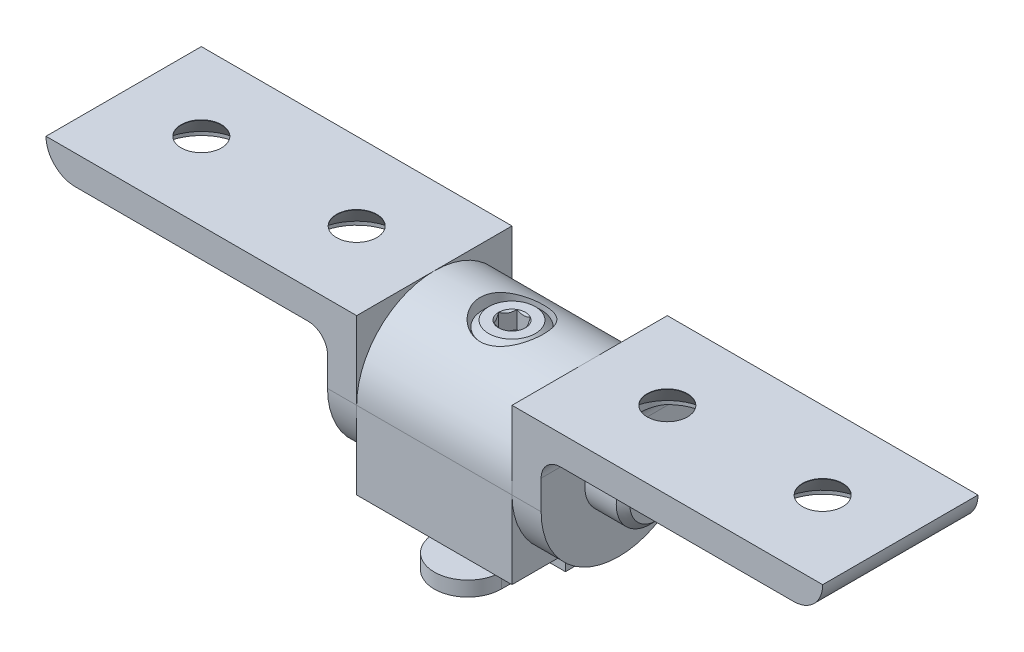
from build123d import *

# Parameters (mm, degrees)
SKETCH2_R           = 3.175
BOSS_EXTRUDE1_DEPTH = 12.7
SKETCH4_W           = 7.9248
SKETCH4_H           = 2.54
BOSS_EXTRUDE3_DEPTH = 3.9624
BOSS_EXTRUDE8_DEPTH = 12.7
SKETCH23_R          = 4.7625
CUT_EXTRUDE7_DEPTH  = 55.091601994
LPATTERN1_COUNT     = 2
LPATTERN1_PITCH     = 25.4
CUT_EXTRUDE1_DEPTH  = 2.8575
SKETCH12_R          = 5.191125
CUT_EXTRUDE3_DEPTH  = 69.063588118
SKETCH13_R          = 3.29819
CUT_EXTRUDE4_DEPTH  = 69.063588118
SKETCH14_R          = 3.175
BOSS_EXTRUDE6_DEPTH = 2.413
SKETCH16_R          = 3.175
BOSS_EXTRUDE7_DEPTH = 25.4
CUT_EXTRUDE5_DEPTH  = 2.8575
CUT_SWEEP1_PITCH    = 1.27
CUT_SWEEP1_FROM     = 0


with BuildPart() as part:
    # Sketch2 → Boss-Extrude1 (new, symmetric)
    with BuildSketch(Plane(origin=(0, 0, 0), x_dir=(0, 0, -1), z_dir=(1, 0, 0))):
        with BuildLine():
            ThreePointArc((-12.7, 12.7), (0, 25.4), (12.7, 12.7))
            Line((12.7, 12.7), (12.7, 0))
            Line((12.7, 0), (-12.7, 0))
            Line((-12.7, 0), (-12.7, 12.7))
        make_face()
        with Locations((0, 12.7)):
            Circle(SKETCH2_R, mode=Mode.SUBTRACT)
    extrude(amount=BOSS_EXTRUDE1_DEPTH, both=True)

    # Sketch4 → Boss-Extrude3 (add, symmetric)
    with BuildSketch(Plane.XY):
        with Locations((8.7376, -1.27)):
            Rectangle(SKETCH4_W, SKETCH4_H)
        with Locations((-8.7376, -1.27)):
            Rectangle(SKETCH4_W, SKETCH4_H)
    extrude(amount=BOSS_EXTRUDE3_DEPTH, both=True)

    # Sketch12 → Cut-Extrude3 (cut, through all)
    with BuildSketch(Plane(origin=(0, 18.415, 0), x_dir=(1, 0, 0), z_dir=(0, 1, 0))):
        with Locations(Location((0, 0, 0), (0, 0, 180))):
            Circle(SKETCH12_R)
    extrude(amount=CUT_EXTRUDE3_DEPTH, mode=Mode.SUBTRACT)

    # Sketch13 → Cut-Extrude4 (cut, through all)
    with BuildSketch(Plane(origin=(0, 18.415, 0), x_dir=(1, 0, 0), z_dir=(0, 1, 0))):
        with Locations(Location((0, 0, 0), (0, 0, 270))):
            Circle(SKETCH13_R)
    extrude(amount=-CUT_EXTRUDE4_DEPTH, mode=Mode.SUBTRACT)


with BuildPart() as body_2:
    # Sketch22 → Boss-Extrude8 (new, symmetric)
    with BuildSketch(Plane.XY):
        with BuildLine():
            Line((-12.7, 0), (-12.7, 25.4))
            Line((-12.7, 25.4), (-63.5, 25.4))
            ThreePointArc((-63.5, 25.4), (-62.105096045, 22.032403955), (-58.7375, 20.6375))
            Line((-58.7375, 20.6375), (-20.6375, 20.6375))
            ThreePointArc((-20.6375, 20.6375), (-18.39243597, 19.70756403), (-17.4625, 17.4625))
            Line((-17.4625, 17.4625), (-17.4625, 0))
            Line((-17.4625, 0), (-12.7, 0))
        make_face()
    extrude(amount=BOSS_EXTRUDE8_DEPTH, both=True)

    # Sketch23 → Cut-Extrude7 (cut, through all)
    with BuildSketch(Plane.ZY.offset(17.4625)):
        with Locations((0, 12.7)):
            Circle(SKETCH23_R)
        with BuildLine():
            Line((-12.7, 12.7), (-12.7, -6.985))
            Line((-12.7, -6.985), (12.7, -6.985))
            Line((12.7, -6.985), (12.7, 12.7))
            ThreePointArc((12.7, 12.7), (0, 0), (-12.7, 12.7))
        make_face()
    extrude(amount=-CUT_EXTRUDE7_DEPTH, mode=Mode.SUBTRACT)

    # Sketch24 → Cut-Revolve1 (revolve, cut)
    with BuildSketch(Plane.XY, mode=Mode.PRIVATE) as cut_revolve1_sk:
        Polygon((-54.09819, 25.4), (-54.09819, 25.331851349), (-57.68213, 21.209), (-57.68213, 20.6375), (-57.68213, 12.7), (-50.8, 12.7), (-50.8, 20.6375), (-50.8, 25.4), align=None)
    cut_revolve1 = revolve(cut_revolve1_sk.sketch.rotate(Axis((-50.8, 0, 0), (0, 1, 0)), 180), axis=Axis((-50.8, 0, 0), (0, 1, 0)), mode=Mode.SUBTRACT)

    # LPattern1: Cut-Revolve1 ×2
    with Locations(*[(i * LPATTERN1_PITCH, 0, 0) for i in range(1, LPATTERN1_COUNT)]):
        add(cut_revolve1, mode=Mode.SUBTRACT)


with BuildPart() as body_3:
    # Sketch8 → Revolve1 (revolve)
    with BuildSketch(Plane.XY, mode=Mode.PRIVATE) as revolve1_sk:
        Polygon((-22.59965, 18.25625), (-17.4625, 18.25625), (-17.4625, 17.4625), (-12.7, 17.4625), (-12.7, 15.875), (-6.35, 15.875), (-6.35, 12.7), (-23.7109, 12.7), (-23.7109, 17.145), align=None)
    revolve(revolve1_sk.sketch.rotate(Axis((-23.7109, 12.7, 0), (1, 0, 0)), 90), axis=Axis((-23.7109, 12.7, 0), (1, 0, 0)))

    # Sketch9 → Cut-Extrude1 (cut)
    with BuildSketch(Plane.ZY.offset(23.7109)):
        Polygon((0, 14.899704526), (-1.905, 13.799852263), (-1.905, 11.600147737), (0, 10.500295474), (1.905, 11.600147737), (1.905, 13.799852263), align=None)
    extrude(amount=-CUT_EXTRUDE1_DEPTH, mode=Mode.SUBTRACT)

    # Cut-Extrude2 cone 1 section (through the dimple's axis) → Cut-Extrude2 (revolve, cut)
    with BuildSketch(Plane(origin=(-23.7109, 12.7, 0), x_dir=(0, 0, 1), z_dir=(0, 1, 0))):
        Polygon((0, 0), (2.199704526, 0), (0, 2.199704526), align=None)
    revolve(axis=Axis((-23.7109, 12.7, 0), (1, 0, 0)), mode=Mode.SUBTRACT)


with BuildPart() as body_4:
    # Mirror2: mirrored copy
    add(body_3.part.mirror(Plane(origin=(0, 0, 0), x_dir=(0, 0, 1), z_dir=(1, 0, 0))))


with BuildPart() as body_5:
    # Mirror2 2: mirrored copy
    add(body_2.part.mirror(Plane(origin=(0, 0, 0), x_dir=(0, 0, 1), z_dir=(1, 0, 0))))


with BuildPart() as body_6:
    # Sketch14 → Boss-Extrude6 (new body)
    with BuildSketch(Plane(origin=(0, -6.985, 0), x_dir=(1, 0, 0), z_dir=(0, 1, 0))):
        with BuildLine():
            Line((5.476875, 7.223125), (5.476875, -7.223125))
            ThreePointArc((5.476875, -7.223125), (0, -12.7), (-5.476875, -7.223125))
            Line((-5.476875, -7.223125), (-5.476875, 7.223125))
            ThreePointArc((-5.476875, 7.223125), (0, 12.7), (5.476875, 7.223125))
        make_face()
        with Locations(Location((0, 0, 0), (0, 0, 270))):
            Circle(SKETCH14_R, mode=Mode.SUBTRACT)
    extrude(amount=BOSS_EXTRUDE6_DEPTH)


with BuildPart() as body_7:
    # Sketch16 → Boss-Extrude7 (new body)
    with BuildSketch(Plane(origin=(0, 18.415, 0), x_dir=(1, 0, 0), z_dir=(0, 1, 0))):
        with Locations(Location((0, 0, 0), (0, 0, 270))):
            Circle(SKETCH16_R)
    extrude(amount=-BOSS_EXTRUDE7_DEPTH)

    # Sketch19 → Revolve3 (revolve)
    with BuildSketch(Plane(origin=(0, 0, 0), x_dir=(0, 0, -1), z_dir=(1, 0, 0)), mode=Mode.PRIVATE) as revolve3_sk:
        Polygon((0, 18.415), (0, 24.765), (3.81, 24.765), (4.7625, 23.8125), (4.7625, 18.415), align=None)
    revolve(revolve3_sk.sketch.rotate(Axis((0, 25.4, 0), (0, -1, 0)), 180), axis=Axis((0, 25.4, 0), (0, -1, 0)))

    # Sketch20 → Cut-Extrude5 (cut)
    with BuildSketch(Plane(origin=(0, 24.765, 0), x_dir=(1, 0, 0), z_dir=(0, 1, 0))):
        Polygon((1.099852263, 1.905), (-1.099852263, 1.905), (-2.199704526, 0), (-1.099852263, -1.905), (1.099852263, -1.905), (2.199704526, 0), align=None)
    extrude(amount=-CUT_EXTRUDE5_DEPTH, mode=Mode.SUBTRACT)

    # Cut-Extrude6 cone 1 section (through the dimple's axis) → Cut-Extrude6 (revolve, cut)
    with BuildSketch(Plane(origin=(0, 24.765, 0), x_dir=(0, 0, 1), z_dir=(1, 0, 0))):
        Polygon((0, 0), (2.199704526, 0), (0, 2.199704526), align=None)
    revolve(axis=Axis((0, 24.765, 0), (0, -1, 0)), mode=Mode.SUBTRACT)

    # Cut-Sweep1: arcs per turn and ends read off the stored shape
    # Cut-Sweep1: the profile of Sketch18 profile screwed along a right-hand helix through 22 turns, 8 arcs to a turn; built about Z, then put on its axis
    cut_sweep1_z = Axis((0, 0, 0), (0, 0, 1))
    cut_sweep1_corners = [(3.1753, 0, -2.381423205), (3.1753, 0, -1.269826795), (2.350110803, 0, -1.74625), (2.350110803, 0, -1.905)]
    with BuildLine(mode=Mode.PRIVATE) as cut_sweep1_profile:
        Line(cut_sweep1_corners[0], cut_sweep1_corners[1])
        Line(cut_sweep1_corners[1], cut_sweep1_corners[2])
        Line(cut_sweep1_corners[2], cut_sweep1_corners[3])
        Line(cut_sweep1_corners[3], cut_sweep1_corners[0])
    cut_sweep1_cap = Face(cut_sweep1_profile.wire())
    cut_sweep1_turn_angles = [0, 22.5, 45, 67.5, 90, 112.5, 135, 157.5, 180, 202.5, 225, 247.5, 270, 292.5, 315, 337.5, 360]
    cut_sweep1_turn_weights = [1, 0.9238795325112867, 1, 0.9238795325112867, 1, 0.9238795325112867, 1, 0.9238795325112867, 1, 0.9238795325112867, 1, 0.9238795325112867, 1, 0.9238795325112867, 1, 0.9238795325112867, 1]
    cut_sweep1_turn_rails = [Edge.make_bspline([Vector(p[0], p[1], 0).rotate(cut_sweep1_z, cut_sweep1_turn_angles[k]) / cut_sweep1_turn_weights[k] + Vector(0, 0, p[2] + CUT_SWEEP1_PITCH * cut_sweep1_turn_angles[k] / 360) for k in range(17)], [0, 0, 0, 1, 1, 2, 2, 3, 3, 4, 4, 5, 5, 6, 6, 7, 7, 8, 8, 8], 2, cut_sweep1_turn_weights) for p in cut_sweep1_corners]
    cut_sweep1_turn_sides = [Face.make_surface_from_curves(cut_sweep1_turn_rails[p[0]], cut_sweep1_turn_rails[p[1]]) for p in [(0, 1), (1, 2), (2, 3), (3, 0)]]
    cut_sweep1 = Plane(origin=(0, 18.415, 0), x_dir=(0, 0, 1), z_dir=(0, -1, 0)) * split(Solid(Shell([*[p.moved(Location((0, 0, CUT_SWEEP1_PITCH * i))) for i in range(22) for p in cut_sweep1_turn_sides], cut_sweep1_cap, cut_sweep1_cap.rotate(cut_sweep1_z, 7920).moved(Location((0, 0, CUT_SWEEP1_PITCH * 7920 / 360)))])), bisect_by=Plane.XY.offset(CUT_SWEEP1_FROM), keep=Keep.TOP, mode=Mode.PRIVATE)
    add(cut_sweep1, mode=Mode.SUBTRACT)


solid = Compound([part.part, body_2.part, body_3.part, body_4.part, body_5.part, body_6.part, body_7.part])
